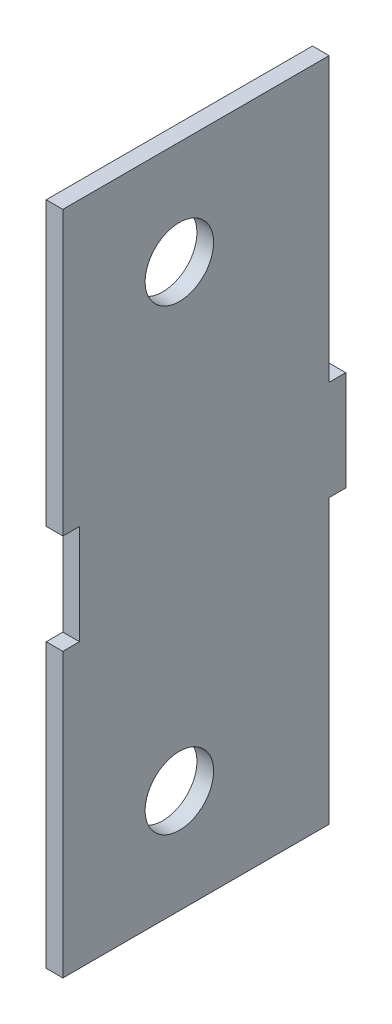
from build123d import *

# Parameters (mm, degrees)
SKETCH2_W           = 25.4
SKETCH2_H           = 63.5
SKETCH2_R           = 3.2639
BOSS_EXTRUDE1_DEPTH = 1.5875
SKETCH3_W           = 1.5875
SKETCH3_H           = 9.525
BOSS_EXTRUDE2_DEPTH = 1.5875
SKETCH3_4_W         = 1.5875
SKETCH3_4_H         = 9.525
CUT_EXTRUDE1_DEPTH  = 3.175


with BuildPart() as part:
    # Sketch2 → Boss-Extrude1 (new body)
    with BuildSketch(Plane(origin=(0, 0, 0), x_dir=(0, 0, -1), z_dir=(1, 0, 0))):
        Rectangle(SKETCH2_W, SKETCH2_H)
        with Locations((-1.5875, 21.844)):
            Circle(SKETCH2_R, mode=Mode.SUBTRACT)
        with Locations((-1.5875, -21.844)):
            Circle(SKETCH2_R, mode=Mode.SUBTRACT)
    extrude(amount=BOSS_EXTRUDE1_DEPTH)

    # Sketch3 → Boss-Extrude2 (add)
    with BuildSketch(Plane(origin=(1.5875, 0, 0), x_dir=(0, 0, -1), z_dir=(1, 0, 0))):
        with Locations((13.49375, 0)):
            Rectangle(SKETCH3_W, SKETCH3_H)
    extrude(amount=-BOSS_EXTRUDE2_DEPTH)

    # Sketch3<4> → Cut-Extrude1 (cut)
    with BuildSketch(Plane(origin=(1.5875, 0, 0), x_dir=(0, 0, -1), z_dir=(1, 0, 0))):
        with Locations((-11.90625, 0)):
            Rectangle(SKETCH3_4_W, SKETCH3_4_H)
    extrude(amount=-CUT_EXTRUDE1_DEPTH, mode=Mode.SUBTRACT)


solid = part.part
